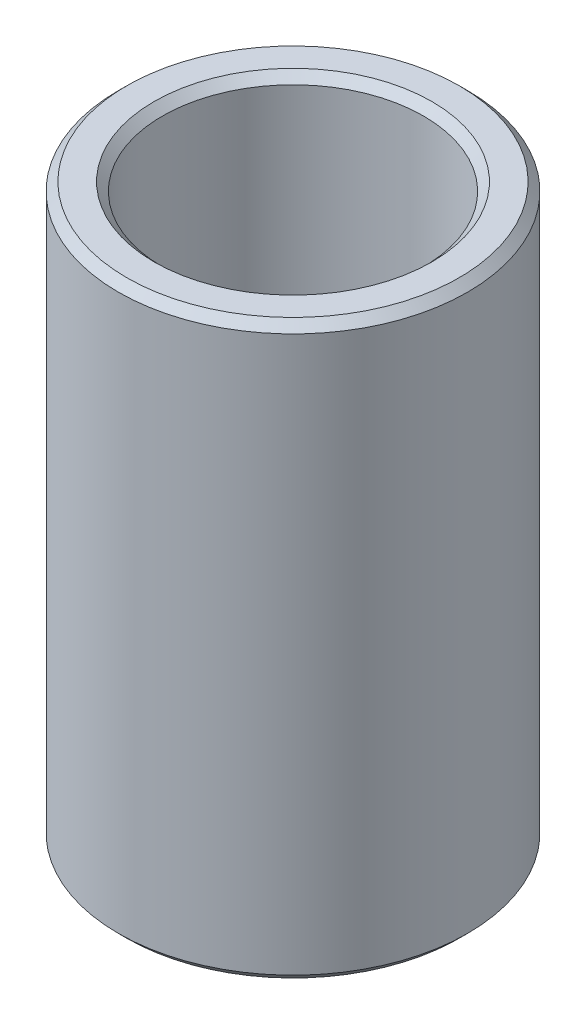
from build123d import *

# Parameters (mm, degrees)
SKETCH1_R           = 25
BOSS_EXTRUDE1_DEPTH = 81.90491486
SKETCH2_R           = 18.693527212
CUT_EXTRUDE1_DEPTH  = 90.209949435
CHAMFER1_SIZE       = 1.196294396


with BuildPart() as part:
    # Sketch1 → Boss-Extrude1 (new body)
    with BuildSketch(Plane(origin=(0, 0, 0), x_dir=(1, 0, 0), z_dir=(0, 1, 0))):
        Circle(SKETCH1_R)
    extrude(amount=BOSS_EXTRUDE1_DEPTH)

    # Sketch2 → Cut-Extrude1 (cut, through all)
    with BuildSketch(Plane(origin=(0, 0, 0), x_dir=(1, 0, 0), z_dir=(0, 1, 0))):
        Circle(SKETCH2_R)
    extrude(amount=CUT_EXTRUDE1_DEPTH, mode=Mode.SUBTRACT)

    # Chamfer1
    chamfer1_edges = [part.edges().sort_by_distance(p)[0] for p in [
        (-18.693527212, 81.90491486, 0),
        (-18.693527212, 0, 0),
        (-25, 0, 0),
        (-25, 81.90491486, 0),
    ]]
    chamfer(chamfer1_edges, length=CHAMFER1_SIZE)


solid = part.part
